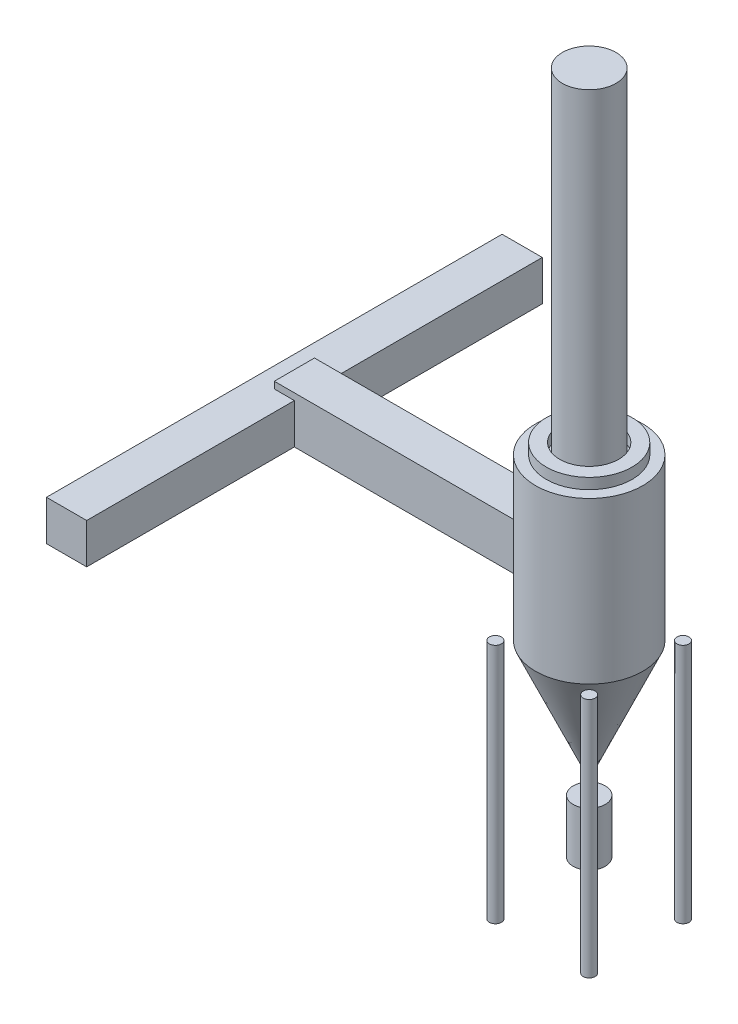
from build123d import *

# Parameters (mm, degrees)
SKETCH1_R            = 45
BOSS_EXTRUDE1_DEPTH  = 1800
SKETCH2_R            = 45
BOSS_EXTRUDE2_DEPTH  = 1800
SKETCH3_R            = 45
BOSS_EXTRUDE3_DEPTH  = 1800
SKETCH4_R            = 45
BOSS_EXTRUDE4_DEPTH  = 1800
BOSS_EXTRUDE5_START  = 400
SKETCH5_R            = 120
BOSS_EXTRUDE5_DEPTH  = 400
BOSS_EXTRUDE7_START  = 1800
SKETCH7_R            = 400
BOSS_EXTRUDE7_DEPTH  = 1200
BOSS_EXTRUDE8_START  = 3000
SKETCH8_R            = 200
BOSS_EXTRUDE8_DEPTH  = 2500
BOSS_EXTRUDE9_START  = 3000
SKETCH9_R            = 320
SKETCH9_R_2          = 220
BOSS_EXTRUDE9_DEPTH  = 80
BOSS_EXTRUDE10_START = 2100
SKETCH10_W           = 300
SKETCH10_H           = 3400
BOSS_EXTRUDE10_DEPTH = 300
BOSS_EXTRUDE11_START = 2100
SKETCH11_W           = 1800
SKETCH11_H           = 300
BOSS_EXTRUDE11_DEPTH = 350


with BuildPart() as part:
    # Sketch1 → Boss-Extrude1 (new body)
    with BuildSketch(Plane(origin=(0, 0, 0), x_dir=(1, 0, 0), z_dir=(0, 1, 0))):
        with Locations((1850, 5150)):
            Circle(SKETCH1_R)
    extrude(amount=BOSS_EXTRUDE1_DEPTH)


with BuildPart() as body_2:
    # Sketch2 → Boss-Extrude2 (new body)
    with BuildSketch(Plane(origin=(0, 0, 0), x_dir=(1, 0, 0), z_dir=(0, 1, 0))):
        with Locations((2550, 5150)):
            Circle(SKETCH2_R)
    extrude(amount=BOSS_EXTRUDE2_DEPTH)


with BuildPart() as body_3:
    # Sketch3 → Boss-Extrude3 (new body)
    with BuildSketch(Plane(origin=(0, 0, 0), x_dir=(1, 0, 0), z_dir=(0, 1, 0))):
        with Locations((1850, 5850)):
            Circle(SKETCH3_R)
    extrude(amount=BOSS_EXTRUDE3_DEPTH)


with BuildPart() as body_4:
    # Sketch4 → Boss-Extrude4 (new body)
    with BuildSketch(Plane(origin=(0, 0, 0), x_dir=(1, 0, 0), z_dir=(0, 1, 0))):
        with Locations((2550, 5850)):
            Circle(SKETCH4_R)
    extrude(amount=BOSS_EXTRUDE4_DEPTH)


with BuildPart() as body_5:
    # Sketch5 → Boss-Extrude5 (new body)
    with BuildSketch(Plane(origin=(0, 0, 0), x_dir=(1, 0, 0), z_dir=(0, 1, 0)).offset(BOSS_EXTRUDE5_START)):
        with Locations((2200, 5500)):
            Circle(SKETCH5_R)
    extrude(amount=BOSS_EXTRUDE5_DEPTH)


with BuildPart() as body_6:
    # Boss-Extrude6 cone 1 section (through the dimple's axis) → Boss-Extrude6 (revolve)
    with BuildSketch(Plane(origin=(2200, 1800, -5500), x_dir=(0, 0, 1), z_dir=(1, 0, 0))):
        Polygon((0, 0), (400, 0), (0, 898.414709562), align=None)
    revolve(axis=Axis((2200, 1800, -5500), (0, -1, 0)))

    # Sketch7 → Boss-Extrude7 (add)
    with BuildSketch(Plane(origin=(0, 0, 0), x_dir=(1, 0, 0), z_dir=(0, 1, 0)).offset(BOSS_EXTRUDE7_START)):
        with Locations((2200, 5500)):
            Circle(SKETCH7_R)
    extrude(amount=BOSS_EXTRUDE7_DEPTH)

    # Sketch8 → Boss-Extrude8 (add)
    with BuildSketch(Plane(origin=(0, 0, 0), x_dir=(1, 0, 0), z_dir=(0, 1, 0)).offset(BOSS_EXTRUDE8_START)):
        with Locations((2200, 5500)):
            Circle(SKETCH8_R)
    extrude(amount=BOSS_EXTRUDE8_DEPTH)

    # Sketch9 → Boss-Extrude9 (add)
    with BuildSketch(Plane(origin=(0, 0, 0), x_dir=(1, 0, 0), z_dir=(0, 1, 0)).offset(BOSS_EXTRUDE9_START)):
        with Locations((2200, 5500)):
            Circle(SKETCH9_R)
        with Locations((2200, 5500)):
            Circle(SKETCH9_R_2, mode=Mode.SUBTRACT)
    extrude(amount=BOSS_EXTRUDE9_DEPTH)


with BuildPart() as body_7:
    # Sketch10 → Boss-Extrude10 (new body)
    with BuildSketch(Plane(origin=(0, 0, 0), x_dir=(1, 0, 0), z_dir=(0, 1, 0)).offset(BOSS_EXTRUDE10_START)):
        with Locations((0, 5500)):
            Rectangle(SKETCH10_W, SKETCH10_H)
    extrude(amount=BOSS_EXTRUDE10_DEPTH)

    # Sketch11 → Boss-Extrude11 (add)
    with BuildSketch(Plane(origin=(0, 0, 0), x_dir=(1, 0, 0), z_dir=(0, 1, 0)).offset(BOSS_EXTRUDE11_START)):
        with Locations((900, 5500)):
            Rectangle(SKETCH11_W, SKETCH11_H)
    extrude(amount=BOSS_EXTRUDE11_DEPTH)


solid = Compound([part.part, body_2.part, body_3.part, body_4.part, body_5.part, body_6.part, body_7.part])
